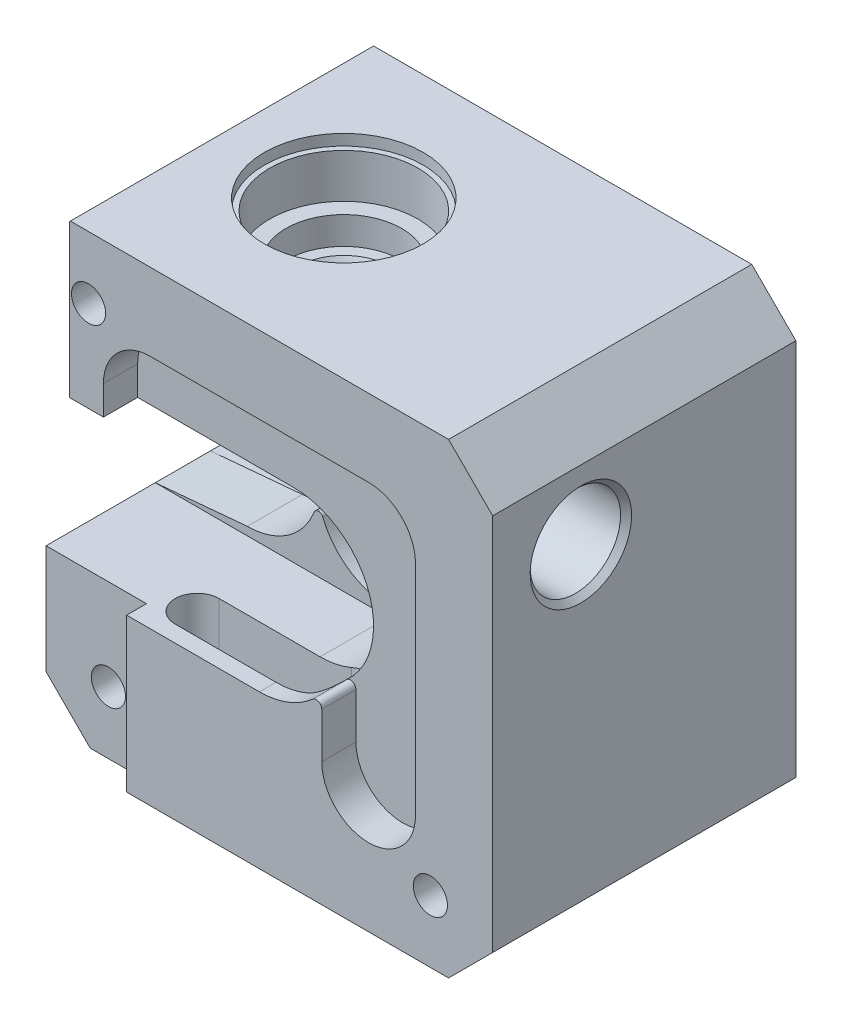
from build123d import *

# Parameters (mm, degrees)
CROQUIS1_W                  = 42.3
CROQUIS1_H                  = 42.3
SALIENTE_EXTRUIR1_DEPTH     = 28
CHAFL_N1_SIZE               = 4
CROQUIS5_W                  = 28.4
CROQUIS5_H                  = 14.5
CORTAR_EXTRUIR4_DEPTH       = 28
CROQUIS6_W                  = 5
CROQUIS6_H                  = 14.5
SALIENTE_EXTRUIR2_DEPTH     = 28.4
CORTAR_EXTRUIR5_REACH       = 64.109
CROQUIS3_R                  = 1.9
CORTAR_EXTRUIR2_DEPTH       = 67.049829674
CORTAR_EXTRUIR6_DEPTH       = 20
CROQUIS9_R                  = 1.55
CORTAR_EXTRUIR7_DEPTH       = 28
CROQUIS10_R                 = 6.725
CORTAR_EXTRUIR8_DEPTH       = 5
CROQUIS11_R                 = 5.25
CORTAR_EXTRUIR9_DEPTH       = 2.5
CROQUIS12_R                 = 3.25
CORTAR_EXTRUIR10_DEPTH      = 6
CROQUIS15_R                 = 7.2
CORTAR_EXTRUIR13_DEPTH      = 1
CHAFL_N2_SIZE               = 1
CHAFL_N2_SIZE2              = 1.732050808
CHAFL_N4_SIZE               = 1
CHAFL_N4_SIZE2              = 1.732050808
CHAFL_N5_SIZE               = 0.7
CHAFL_N5_SIZE2              = 1.212435565
CORTAR_EXTRUIR17_START      = -28.4
CORTAR_EXTRUIR17_DEPTH      = 13.9
CROQUIS21_W                 = 0.6029178
CROQUIS21_H                 = 4.2
CORTAR_EXTRUIR19_DEPTH      = 63.108534035
CROQUIS22_R                 = 2.5
CORTAR_EXTRUIR20_DEPTH      = 67.049829674
REDONDEO1_R                 = 0.4
CROQUIS25_W                 = 42.3
CROQUIS25_H                 = 0.5
CORTAR_EXTRUIR23_DEPTH      = 67.049829674
CROQUIS34_W                 = 1.8
CROQUIS34_H                 = 13.9
CROQUIS34_W_2               = 4.5
CORTAR_EXTRUIR28_DEPTH      = 9.1
REDONDEO6_START             = 5.5
REDONDEO6_DEPTH             = 22
REDONDEO6_2_DEPTH           = 10.464246
REDONDEO6_3_DEPTH           = 1.5
REDONDEO6_START_2           = 13.9
REDONDEO6_4_DEPTH           = 1.861113622
REDONDEO6_START_3           = 1.5
REDONDEO6_5_DEPTH           = 4
REDONDEO6_6_DEPTH           = 4
CORTAR_EXTRUIR29_DEPTH      = 3.9
REDONDEO7_R                 = 2
CROQUIS24_R                 = 4.1
CORTAR_EXTRUIR22_DEPTH      = 17
CHAFL_N7_SIZE               = 0.5
CORTAR_EXTRUIR30_START      = -3.1
CORTAR_EXTRUIR30_DEPTH      = 3.1
REDONDEO10_R                = 0.5
CORTAR_EXTRUIR31_DEPTH      = 62.872611065
CORTAR_EXTRUIR31_DEPTH_BACK = 62.872611065


with BuildPart() as part:
    # Croquis1 → Saliente-Extruir1 (new body)
    with BuildSketch(Plane.XY):
        with Locations((21.15, 21.15)):
            Rectangle(CROQUIS1_W, CROQUIS1_H)
    extrude(amount=SALIENTE_EXTRUIR1_DEPTH)

    # Chaflán1
    chafl_n1_edges = [part.edges().sort_by_distance(p)[0] for p in [
        (0, 42.3, 14),
        (42.3, 42.3, 14),
        (42.3, 0, 14),
        (0, 0, 14),
    ]]
    chamfer(chafl_n1_edges, length=CHAFL_N1_SIZE)

    # Croquis5 → Cortar-Extruir4 (cut)
    with BuildSketch(Plane.XY.offset(28)):
        with Locations((14.2, 21.15)):
            Rectangle(CROQUIS5_W, CROQUIS5_H)
    extrude(amount=-CORTAR_EXTRUIR4_DEPTH, mode=Mode.SUBTRACT)

    # Croquis6 → Saliente-Extruir2 (add)
    with BuildSketch(Plane.ZY):
        with Locations((14.2, 21.15)):
            Rectangle(CROQUIS6_W, CROQUIS6_H)
    extrude(amount=-SALIENTE_EXTRUIR2_DEPTH)

    # Croquis7 → Cortar-Extruir5 (cut, up to next)
    with BuildSketch(Plane.XY.offset(16.7), mode=Mode.PRIVATE) as cortar_extruir5_sk1:
        with BuildLine():
            Line((0, 27.65), (8.35, 27.65))
            ThreePointArc((8.35, 27.65), (12.577883631, 26.087104415), (14.772616289, 22.15))
            Line((14.772616289, 22.15), (14.828607748, 22.15))
            ThreePointArc((14.828607748, 22.15), (27.55, 21.15), (14.828607748, 20.15))
            Line((14.828607748, 20.15), (14.772616289, 20.15))
            ThreePointArc((14.772616289, 20.15), (12.577883631, 16.212895585), (8.35, 14.65))
            Line((8.35, 14.65), (0, 14.65))
            ThreePointArc((0, 14.65), (-6.5, 21.15), (0, 27.65))
        make_face()
    cortar_extruir5_tool1 = extrude(cortar_extruir5_sk1.sketch, amount=-CORTAR_EXTRUIR5_REACH, mode=Mode.PRIVATE) & part.part
    add(cortar_extruir5_tool1.solids().sort_by_distance((10.077992, 21.15, 16.7))[0], mode=Mode.SUBTRACT)

    # Croquis3 → Cortar-Extruir2 (cut, through all)
    with BuildSketch(Plane(origin=(0, 42.3, 0), x_dir=(1, 0, 0), z_dir=(0, 1, 0))):
        with Locations(Location((14.6, -14.2, 0), (0, 0, 270))):
            Circle(CROQUIS3_R)
    extrude(amount=-CORTAR_EXTRUIR2_DEPTH, mode=Mode.SUBTRACT)

    # Croquis8 → Cortar-Extruir6 (cut)
    with BuildSketch(Plane(origin=(0, 0, 11.7), x_dir=(-1, 0, 0), z_dir=(0, 0, -1))):
        Polygon((-8.35, 14.65), (0, 13.9), (0, 14.65), align=None)
        Polygon((0, 28.4), (-8.35, 27.65), (0, 27.65), align=None)
    extrude(amount=-CORTAR_EXTRUIR6_DEPTH, mode=Mode.SUBTRACT)

    # Croquis9 → Cortar-Extruir7 (cut)
    with BuildSketch(Plane(origin=(0, 0, 0), x_dir=(-1, 0, 0), z_dir=(0, 0, -1))):
        with Locations((-5.65, 36.65)):
            Circle(CROQUIS9_R)
        with Locations((-5.65, 5.65)):
            Circle(CROQUIS9_R)
        with Locations((-36.65, 5.65)):
            Circle(CROQUIS9_R)
    extrude(amount=-CORTAR_EXTRUIR7_DEPTH, mode=Mode.SUBTRACT)

    # Croquis10 → Cortar-Extruir8 (cut)
    with BuildSketch(Plane(origin=(0, 42.3, 0), x_dir=(1, 0, 0), z_dir=(0, 1, 0))):
        with Locations(Location((14.6, -14.2, 0), (0, 0, 270))):
            Circle(CROQUIS10_R)
    cortar_extruir8 = extrude(amount=-CORTAR_EXTRUIR8_DEPTH, mode=Mode.SUBTRACT)

    # Croquis11 → Cortar-Extruir9 (cut)
    with BuildSketch(Plane(origin=(0, 37.3, 0), x_dir=(1, 0, 0), z_dir=(0, 1, 0))):
        with Locations(Location((14.6, -14.2, 0), (0, 0, 270))):
            Circle(CROQUIS11_R)
    cortar_extruir9 = extrude(amount=-CORTAR_EXTRUIR9_DEPTH, mode=Mode.SUBTRACT)

    # Croquis12 → Cortar-Extruir10 (cut)
    with BuildSketch(Plane(origin=(0, 34.8, 0), x_dir=(1, 0, 0), z_dir=(0, 1, 0))):
        with Locations(Location((14.6, -14.2, 0), (0, 0, 270))):
            Circle(CROQUIS12_R)
    cortar_extruir10 = extrude(amount=-CORTAR_EXTRUIR10_DEPTH, mode=Mode.SUBTRACT)

    # Croquis15 → Cortar-Extruir13 (cut)
    with BuildSketch(Plane(origin=(0, 42.3, 0), x_dir=(1, 0, 0), z_dir=(0, 1, 0))):
        with Locations(Location((14.6, -14.2, 0), (0, 0, 270))):
            Circle(CROQUIS15_R)
    cortar_extruir13 = extrude(amount=-CORTAR_EXTRUIR13_DEPTH, mode=Mode.SUBTRACT)

    # Chaflán2
    chafl_n2_edges = [part.edges().sort_by_distance(p)[0] for p in [
        (14.6, 34.8, 10.95),
    ]]
    chafl_n2_side = [part.faces().sort_by_distance(p)[0] for p in [
        (14.6, 34.8, 9.098492424),
    ]]
    chamfer(chafl_n2_edges, length=CHAFL_N2_SIZE, length2=CHAFL_N2_SIZE2, reference=chafl_n2_side[0])

    # Simetría1: Cortar-Extruir8, Cortar-Extruir9, Cortar-Extruir10, Cortar-Extruir13 across plane
    add(cortar_extruir8.mirror(Plane.ZX.offset(21.15)), mode=Mode.SUBTRACT)
    add(cortar_extruir9.mirror(Plane.ZX.offset(21.15)), mode=Mode.SUBTRACT)
    add(cortar_extruir10.mirror(Plane.ZX.offset(21.15)), mode=Mode.SUBTRACT)
    add(cortar_extruir13.mirror(Plane.ZX.offset(21.15)), mode=Mode.SUBTRACT)

    # Chaflán4
    chafl_n4_edges = [part.edges().sort_by_distance(p)[0] for p in [
        (14.6, 7.5, 10.95),
    ]]
    chafl_n4_side = [part.faces().sort_by_distance(p)[0] for p in [
        (14.6, 7.5, 9.098492424),
    ]]
    chamfer(chafl_n4_edges, length=CHAFL_N4_SIZE, length2=CHAFL_N4_SIZE2, reference=chafl_n4_side[0])

    # Chaflán5
    chafl_n5_edges = [part.edges().sort_by_distance(p)[0] for p in [
        (14.6, 13.5, 12.3),
    ]]
    chafl_n5_side = [part.faces().sort_by_distance(p)[0] for p in [
        (14.6, 13.5, 11.041923882),
    ]]
    chamfer(chafl_n5_edges, length=CHAFL_N5_SIZE, length2=CHAFL_N5_SIZE2, reference=chafl_n5_side[0])

    # Croquis18 → Cortar-Extruir17 (cut)
    with BuildSketch(Plane(origin=(0, 42.3, 0), x_dir=(1, 0, 0), z_dir=(0, 1, 0)).offset(CORTAR_EXTRUIR17_START)):
        with BuildLine():
            Line((12, -5.5), (24, -5.5))
            ThreePointArc((24, -5.5), (26, -3.5), (24, -1.5))
            Line((24, -1.5), (12, -1.5))
            ThreePointArc((12, -1.5), (10, -3.5), (12, -5.5))
        make_face()
    extrude(amount=-CORTAR_EXTRUIR17_DEPTH, mode=Mode.SUBTRACT)

    # Croquis21 → Cortar-Extruir19 (cut, through all)
    with BuildSketch(Plane.XY.offset(16.7)):
        with Locations((14.8028815, 21.15)):
            Rectangle(CROQUIS21_W, CROQUIS21_H)
    extrude(amount=-CORTAR_EXTRUIR19_DEPTH, mode=Mode.SUBTRACT)

    # Croquis22 → Cortar-Extruir20 (cut, through all)
    with BuildSketch(Plane.ZY):
        with Locations(Location((8, 32.05, 0), (0, 0, 270))):
            Circle(CROQUIS22_R)
    extrude(amount=-CORTAR_EXTRUIR20_DEPTH, mode=Mode.SUBTRACT)

    # Redondeo1
    # the kernel refuses this fillet: 0.4 mm, written as the material it takes off along each edge
    with BuildSketch(Plane(origin=(14.5014226, 19.05, 13.001937654), x_dir=(1, 0, 0), z_dir=(0, 0, -1))) as redondeo1_piece_1:
        with BuildLine():
            CenterArc((0.279751477, 0.4), REDONDEO1_R, 201.242672427, 68.757327573)
            ThreePointArc((-0.093070209, 0.255072464), (-0.04520308, 0.128022258), (0, 0))
            Line((0, 0), (0.279751477, 0))
        make_face()
    extrude(amount=2.001316345, mode=Mode.SUBTRACT)
    with BuildSketch(Plane(origin=(15.1043404, 19.05, 13.063421956), x_dir=(0.3479633367587748, -0.9375081419762173, 0), z_dir=(0, 0, -1))) as redondeo1_piece_2:
        with BuildLine():
            CenterArc((0.278232878, 0.399911132), REDONDEO1_R, 200.362794187, 68.429421699)
            Line((-0.096770379, 0.260725797), (0, 0))
            ThreePointArc((0, 0), (0.134900789, 0.001421894), (0.269801578, 0))
        make_face()
    extrude(amount=2.058684709, mode=Mode.SUBTRACT)
    with BuildSketch(Plane(origin=(15.1043404, 19.05, 17.395262754), x_dir=(-1, 0, 0), z_dir=(0, 0, -1))) as redondeo1_piece_3:
        with BuildLine():
            CenterArc((0.278105101, -0.4), REDONDEO1_R, 90, 68.429421698)
            ThreePointArc((-0.093881057, -0.252941176), (-0.045607491, -0.126965355), (0, 0))
            Line((0, 0), (0.278105101, 0))
        make_face()
    extrude(amount=2.058684708, mode=Mode.SUBTRACT)
    with BuildSketch(Plane(origin=(14.5014226, 19.05, 17.399378692), x_dir=(1, 0, 0), z_dir=(0, 0, -1))) as redondeo1_piece_4:
        with BuildLine():
            CenterArc((0.279751477, 0.4), REDONDEO1_R, 201.242672427, 68.757327573)
            ThreePointArc((-0.093070209, 0.255072464), (-0.04520308, 0.128022258), (0, 0))
            Line((0, 0), (0.279751477, 0))
        make_face()
    extrude(amount=2.001316321, mode=Mode.SUBTRACT)
    with BuildSketch(Plane(origin=(15.1043404, 23.25, 17.395262754), x_dir=(0.34796333675886587, 0.9375081419761836, 0), z_dir=(0, 0, -1))) as redondeo1_piece_5:
        with BuildLine():
            CenterArc((0.278232878, -0.399911132), REDONDEO1_R, 91.207784114, 68.429421699)
            Line((-0.096770379, -0.260725797), (0, 0))
            ThreePointArc((0, 0), (0.134900789, -0.001421894), (0.269801578, 0))
        make_face()
    extrude(amount=2.058684708, mode=Mode.SUBTRACT)
    with BuildSketch(Plane(origin=(15.1043404, 23.25, 13.063421956), x_dir=(0.34796333675886587, 0.9375081419761836, 0), z_dir=(0, 0, -1))) as redondeo1_piece_6:
        with BuildLine():
            CenterArc((0.278232878, -0.399911132), REDONDEO1_R, 91.207784114, 68.429421699)
            Line((-0.096770379, -0.260725797), (0, 0))
            ThreePointArc((0, 0), (0.134900789, -0.001421894), (0.269801578, 0))
        make_face()
    extrude(amount=2.058684709, mode=Mode.SUBTRACT)
    with BuildSketch(Plane(origin=(14.5014226, 23.25, 13.001937654), x_dir=(1, 0, 0), z_dir=(0, 0, -1))) as redondeo1_piece_7:
        with BuildLine():
            CenterArc((0.279751477, -0.4), REDONDEO1_R, 90, 68.757327573)
            ThreePointArc((-0.093070209, -0.255072464), (-0.04520308, -0.128022258), (0, 0))
            Line((0, 0), (0.279751477, 0))
        make_face()
    extrude(amount=2.001316345, mode=Mode.SUBTRACT)
    with BuildSketch(Plane(origin=(14.5014226, 23.25, 17.399378692), x_dir=(1, 0, 0), z_dir=(0, 0, -1))) as redondeo1_piece_8:
        with BuildLine():
            CenterArc((0.279751477, -0.4), REDONDEO1_R, 90, 68.757327573)
            ThreePointArc((-0.093070209, -0.255072464), (-0.04520308, -0.128022258), (0, 0))
            Line((0, 0), (0.279751477, 0))
        make_face()
    extrude(amount=2.001316321, mode=Mode.SUBTRACT)

    # Croquis25 → Cortar-Extruir23 (cut, through all)
    with BuildSketch(Plane(origin=(0, 42.3, 0), x_dir=(1, 0, 0), z_dir=(0, 1, 0))):
        with Locations((21.15, -27.75)):
            Rectangle(CROQUIS25_W, CROQUIS25_H)
    extrude(amount=-CORTAR_EXTRUIR23_DEPTH, mode=Mode.SUBTRACT)

    # Croquis34 → Cortar-Extruir28 (cut)
    with BuildSketch(Plane.ZY):
        with Locations((0.9, 6.95)):
            Rectangle(CROQUIS34_W, CROQUIS34_H)
        with Locations((22.05, 6.95)):
            Rectangle(CROQUIS34_W_2, CROQUIS34_H)
    extrude(amount=-CORTAR_EXTRUIR28_DEPTH, mode=Mode.SUBTRACT)

    # Redondeo6: read off the stored shape, not the designer's step
    # Redondeo6 outline → Redondeo6 (add)
    with BuildSketch(Plane.XY.offset(REDONDEO6_START)):
        with BuildLine():
            Line((28.4, 13.9), (28.4, 21.15))
            ThreePointArc((28.4, 21.15), (26.276524164, 16.023475836), (21.15, 13.9))
            Line((21.15, 13.9), (28.4, 13.9))
        make_face()
        with BuildLine():
            ThreePointArc((21.15, 28.4), (26.276524164, 26.276524164), (28.4, 21.15))
            Line((28.4, 21.15), (28.4, 28.4))
            Line((28.4, 28.4), (21.15, 28.4))
        make_face()
    extrude(amount=REDONDEO6_DEPTH)

    # Redondeo6 2 outline → Redondeo6 2 (add)
    with BuildSketch(Plane.XY):
        with BuildLine():
            ThreePointArc((21.15, 28.4), (26.276524164, 26.276524164), (28.4, 21.15))
            Line((28.4, 21.15), (28.4, 28.4))
            Line((28.4, 28.4), (21.15, 28.4))
        make_face()
    extrude(amount=REDONDEO6_2_DEPTH)

    # Redondeo6 3 outline → Redondeo6 3 (add)
    with BuildSketch(Plane.XY):
        with BuildLine():
            Line((28.4, 13.9), (28.4, 21.15))
            ThreePointArc((28.4, 21.15), (26.276524164, 16.023475836), (21.15, 13.9))
            Line((21.15, 13.9), (28.4, 13.9))
        make_face()
    extrude(amount=REDONDEO6_3_DEPTH)

    # Redondeo6 4 outline → Redondeo6 4 (add)
    with BuildSketch(Plane(origin=(0, 0, 0), x_dir=(1, 0, 0), z_dir=(0, 1, 0)).offset(REDONDEO6_START_2)):
        with BuildLine():
            ThreePointArc((24, -1.5), (26, -3.5), (24, -5.5))
            Line((24, -5.5), (28.4, -5.5))
            Line((28.4, -5.5), (28.4, -1.5))
            Line((28.4, -1.5), (24, -1.5))
        make_face()
    extrude(amount=REDONDEO6_4_DEPTH)

    # Redondeo6 5 outline → Redondeo6 5 (cut)
    with BuildSketch(Plane.XY.offset(REDONDEO6_START_3)):
        with BuildLine():
            ThreePointArc((23, 14.140007132), (24.596659727, 14.771674457), (25.999990063, 15.761113622))
            Line((25.999990063, 15.761113622), (23, 15.761113622))
            Line((23, 15.761113622), (23, 14.140007132))
        make_face()
    extrude(amount=REDONDEO6_5_DEPTH, mode=Mode.SUBTRACT)

    # Redondeo6 6 outline → Redondeo6 6 (add)
    with BuildSketch(Plane.XY.offset(REDONDEO6_START_3)):
        with BuildLine():
            Line((28.4, 15.761113622), (28.4, 21.15))
            ThreePointArc((28.4, 21.15), (27.772874299, 18.200417653), (25.999990063, 15.761113622))
            Line((25.999990063, 15.761113622), (28.4, 15.761113622))
        make_face()
    extrude(amount=REDONDEO6_6_DEPTH)

    # Croquis35 → Cortar-Extruir29 (cut)
    with BuildSketch(Plane.ZY):
        with BuildLine():
            Line((24.7, 27.4), (24.7, 29.15))
            ThreePointArc((24.7, 29.15), (22.21040764, 35.16040764), (16.2, 37.65))
            Line((16.2, 37.65), (12.7, 37.65))
            Line((12.7, 37.65), (12.7, 42.3))
            Line((12.7, 42.3), (0, 42.3))
            Line((0, 42.3), (0, 27.4))
            Line((0, 27.4), (24.7, 27.4))
        make_face()
    extrude(amount=-CORTAR_EXTRUIR29_DEPTH, mode=Mode.SUBTRACT)

    # Redondeo7
    redondeo7_edges = [part.edges().sort_by_distance(p)[0] for p in [
        (1.95, 37.65, 12.7),
    ]]
    fillet(redondeo7_edges, radius=REDONDEO7_R)

    # Croquis24 → Cortar-Extruir22 (cut)
    with BuildSketch(Plane(origin=(42.3, 0, 0), x_dir=(0, 0, -1), z_dir=(1, 0, 0))):
        with Locations(Location((-8, 32.05, 0), (0, 0, 90))):
            Circle(CROQUIS24_R)
    extrude(amount=-CORTAR_EXTRUIR22_DEPTH, mode=Mode.SUBTRACT)

    # Chaflán7
    chafl_n7_edges = [part.edges().sort_by_distance(p)[0] for p in [
        (42.3, 27.95, 8),
    ]]
    chamfer(chafl_n7_edges, length=CHAFL_N7_SIZE)

    # Cortar-Extruir30: read off the stored shape, not the designer's step
    # Cortar-Extruir30 outline → Cortar-Extruir30 (cut)
    with BuildSketch(Plane(origin=(0, 0, 0), x_dir=(-1, 0, 0), z_dir=(0, 0, -1)).offset(CORTAR_EXTRUIR30_START)):
        with BuildLine():
            ThreePointArc((-31.049494937, 35.299494937), (-34.054698757, 34.054698757), (-35.299494937, 31.049494937))
            Line((-35.299494937, 31.049494937), (-35.299494937, 11.250505063))
            ThreePointArc((-35.299494937, 11.250505063), (-31.049494937, 7.000505063), (-26.799494937, 11.250505063))
            Line((-26.799494937, 11.250505063), (-26.799494937, 16.606245279))
            ThreePointArc((-26.799494937, 16.606245279), (-27.988177327, 18.741301004), (-28.4, 21.15))
            ThreePointArc((-28.4, 21.15), (-26.276524164, 26.276524164), (-21.15, 28.4))
            Line((-21.15, 28.4), (-7.000505063, 28.4))
            Line((-7.000505063, 28.4), (-7.000505063, 31.049494937))
            ThreePointArc((-7.000505063, 31.049494937), (-8.245301243, 34.054698757), (-11.250505063, 35.299494937))
            Line((-11.250505063, 35.299494937), (-31.049494937, 35.299494937))
        make_face()
    extrude(amount=CORTAR_EXTRUIR30_DEPTH, mode=Mode.SUBTRACT)

    # Redondeo10
    # the kernel refuses this fillet: 0.5 mm, written as the material it takes off along each edge
    with BuildSketch(Plane(origin=(26.799494937, 16.606245279, 3.1), x_dir=(0, -1, 0), z_dir=(0, 0, -1))) as redondeo10_piece_1:
        with BuildLine():
            CenterArc((1.248067264, 0.5), REDONDEO10_R, 138.359781707, 131.640218293)
            ThreePointArc((0.874401329, 0.83222548), (0.454551629, 0.397882457), (0, 0))
            Line((0, 0), (1.248067264, 0))
        make_face()
    extrude(amount=1.6, mode=Mode.SUBTRACT)
    with BuildSketch(Plane(origin=(26.799494937, 16.606245279, 1.5), x_dir=(-0.6894215654155046, -0.7243603420536183, 0), z_dir=(0, 0, -1))) as redondeo10_piece_2:
        with BuildLine():
            CenterArc((1.248761213, -0.498264316), REDONDEO10_R, 94.77544353, 131.640218285)
            Line((0.90405043, -0.860444487), (0, 0))
            ThreePointArc((0, 0), (0.603567919, -0.025167423), (1.207135839, 0))
        make_face()
    extrude(amount=4.620168159, mode=Mode.SUBTRACT)

    # Croquis37 → Cortar-Extruir31 (cut, two sides: drawn at the far end of the back side and taken through both)
    with BuildSketch(Plane(origin=(0, 0, 11.7), x_dir=(-1, 0, 0), z_dir=(0, 0, -1)).offset(-CORTAR_EXTRUIR31_DEPTH_BACK)):
        with BuildLine():
            Line((-22, 27.55), (-21.15, 27.55))
            ThreePointArc((-21.15, 27.55), (-14.75, 21.15), (-21.15, 14.75))
            Line((-21.15, 14.75), (-22, 14.75))
            ThreePointArc((-22, 14.75), (-28.4, 21.15), (-22, 27.55))
        make_face()
    extrude(amount=CORTAR_EXTRUIR31_DEPTH + CORTAR_EXTRUIR31_DEPTH_BACK, mode=Mode.SUBTRACT)


with BuildPart() as body_2:
    # Simetría2: mirrored copy
    add(part.part.mirror(Plane(origin=(0, 0, 13.75), x_dir=(1, 0, 0), z_dir=(0, 0, -1))))


solid = body_2.part
